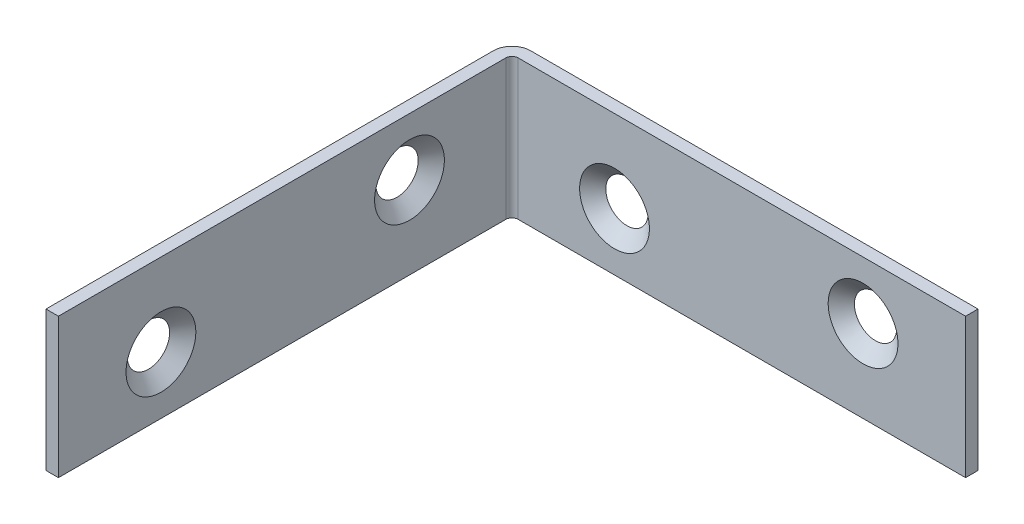
from build123d import *

# Parameters (mm, degrees)
EXTRUDE_THIN2_DEPTH            = 9.0043
SKETCH4_R                      = 2.2479
CUT_EXTRUDE2_DEPTH             = 86.321916719
CHAMFER1_SIZE                  = 2.2479
CHAMFER1_SIZE_2                = 2.024018251
CIRPATTERN2_COUNT              = 2
CIRPATTERN2_ANGLE              = 180
CHAMFER1_OF_CIRPATTERN2_SIZE   = 2.024018251
CHAMFER1_OF_CIRPATTERN2_SIZE_2 = 2.2479


with BuildPart() as part:
    # Sketch3 → Extrude-Thin2 (new, symmetric)
    with BuildSketch(Plane(origin=(0, 0, 0), x_dir=(1, 0, 0), z_dir=(0, 1, 0))):
        with BuildLine():
            Line((0, -59.9948), (0, -2.4003))
            ThreePointArc((0, -2.4003), (0.703031593, -0.703031593), (2.4003, 0))
            Line((2.4003, 0), (59.9948, 0))
            Line((59.9948, 0), (59.9948, -1.6002))
            Line((59.9948, -1.6002), (2.4003, -1.6002))
            ThreePointArc((2.4003, -1.6002), (1.834543864, -1.834543864), (1.6002, -2.4003))
            Line((1.6002, -2.4003), (1.6002, -59.9948))
            Line((1.6002, -59.9948), (0, -59.9948))
        make_face()
    extrude(amount=EXTRUDE_THIN2_DEPTH, both=True)

    # Sketch4 → Cut-Extrude2 (cut, through all)
    with BuildSketch(Plane.XY):
        with Locations(Location((46.7975, 1.5875, 0), (0, 0, 180))):
            Circle(SKETCH4_R)
        with Locations(Location((14.7975, -1.5875, 0), (0, 0, 180))):
            Circle(SKETCH4_R)
    cut_extrude2 = extrude(amount=CUT_EXTRUDE2_DEPTH, mode=Mode.SUBTRACT)

    # Chamfer1
    # the kernel refuses this chamfer: 2.2479, 2.024018251 mm, written as the material it takes off along each edge
    with BuildSketch(Plane(origin=(46.7975, 1.5875, 1.6002), x_dir=(-1, 0, 0), z_dir=(0, -1, 0))) as chamfer1_piece_1:
        Polygon((2.2479 + CHAMFER1_SIZE, 0), (2.2479, CHAMFER1_SIZE_2), (2.2479, 0), align=None)
    revolve(axis=Axis((46.7975, 1.5875, 1.6002), (0, 0, -1)), mode=Mode.SUBTRACT)
    with BuildSketch(Plane(origin=(14.7975, -1.5875, 1.6002), x_dir=(-1, 0, 0), z_dir=(0, -1, 0))) as chamfer1_piece_2:
        Polygon((2.2479 + CHAMFER1_SIZE, 0), (2.2479, CHAMFER1_SIZE_2), (2.2479, 0), align=None)
    revolve(axis=Axis((14.7975, -1.5875, 1.6002), (0, 0, -1)), mode=Mode.SUBTRACT)

    # CirPattern2: Cut-Extrude2 ×2 about axis
    cirpattern2_axis = Axis((0, 0, 0), (0.7071067811865462, 0, 0.7071067811865489))
    for i in range(1, CIRPATTERN2_COUNT):
        add(cut_extrude2.rotate(cirpattern2_axis, i * CIRPATTERN2_ANGLE / (CIRPATTERN2_COUNT - 1)), mode=Mode.SUBTRACT)

    # Chamfer1 of CirPattern2
    # the kernel refuses this chamfer: 2.2479, 2.024018251 mm, written as the material it takes off along each edge
    with BuildSketch(Plane(origin=(1.6002, -1.5875, 46.7975), x_dir=(0, 0, -1), z_dir=(0, 1, 0))) as chamfer1_of_cirpattern2_piece_1:
        Polygon((2.2479, CHAMFER1_OF_CIRPATTERN2_SIZE), (2.2479 + CHAMFER1_OF_CIRPATTERN2_SIZE_2, 0), (2.2479, 0), align=None)
    revolve(axis=Axis((1.6002, -1.5875, 46.7975), (-1, 0, 0)), mode=Mode.SUBTRACT)
    with BuildSketch(Plane(origin=(1.6002, 1.5875, 14.7975), x_dir=(0, 0, -1), z_dir=(0, 1, 0))) as chamfer1_of_cirpattern2_piece_2:
        Polygon((2.2479, CHAMFER1_OF_CIRPATTERN2_SIZE), (2.2479 + CHAMFER1_OF_CIRPATTERN2_SIZE_2, 0), (2.2479, 0), align=None)
    revolve(axis=Axis((1.6002, 1.5875, 14.7975), (-1, 0, 0)), mode=Mode.SUBTRACT)


solid = part.part
